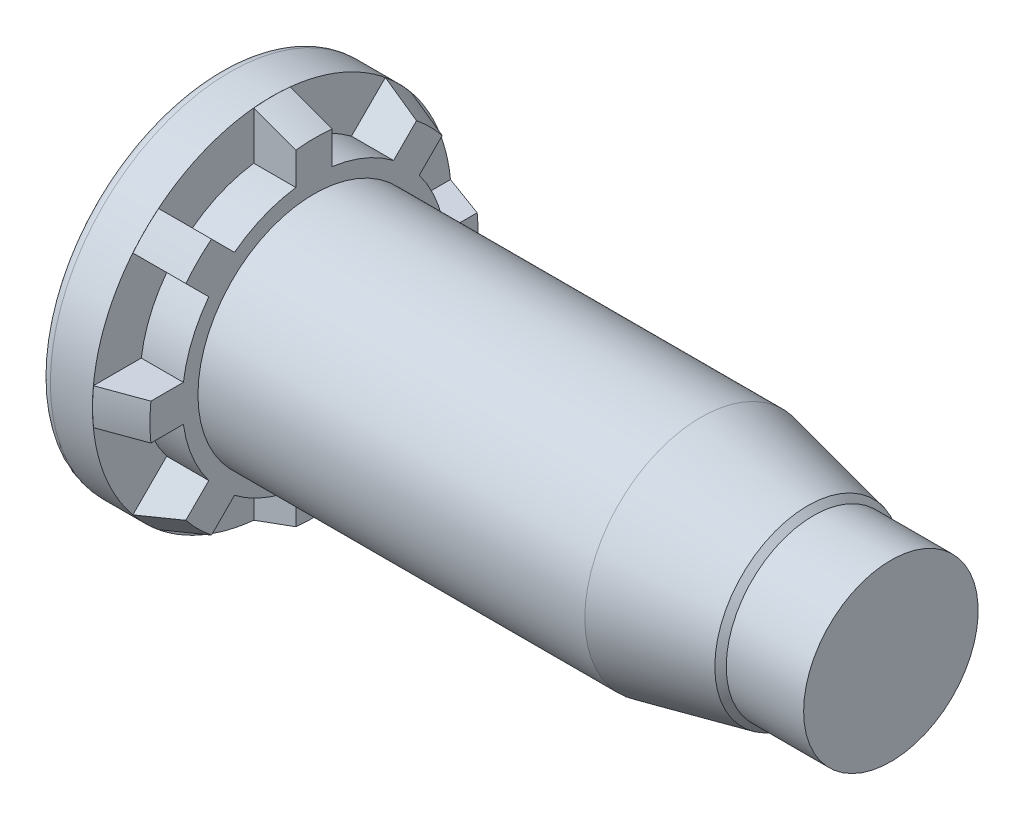
from build123d import *

# Parameters (mm, degrees)
RIBCUT_START     = -1.7272
RIBCUT_DEPTH     = 1.7272
RIBCUTSPAT_COUNT = 8
RIBCUTSPAT_ANGLE = 315


with BuildPart() as part:
    # BodySke → BaseBody (revolve)
    with BuildSketch(Plane.XY):
        with BuildLine():
            Line((-2.159, 6.9342), (-2.159, 0))
            Line((-2.159, 0), (25.4, 0))
            Line((25.4, 0), (25.4, 3.5814))
            Line((25.4, 3.5814), (22.225, 3.5814))
            Line((22.225, 3.5814), (21.99005, 3.81635))
            Line((21.99005, 3.81635), (17.6022, 4.7625))
            Line((17.6022, 4.7625), (1.7272, 4.7625))
            Line((1.7272, 4.7625), (1.7272, 6.735735096))
            Line((1.7272, 6.735735096), (0.00254, 7.36346))
            Line((0.00254, 7.36346), (0, 7.36346))
            Line((0, 7.36346), (0, 7.366))
            Line((0, 7.366), (-1.7272, 7.366))
            ThreePointArc((-1.7272, 7.366), (-2.032528708, 7.239528708), (-2.159, 6.9342))
        make_face()
    revolve(axis=Axis((0, 0, 0), (1, 0, 0)))

    # RibCutSke → RibCut (cut)
    with BuildSketch(Plane(origin=(1.7272, 1.794401132, -0.090952894), x_dir=(0, 0, -1), z_dir=(1, 0, 0)).offset(RIBCUT_START)):
        with BuildLine():
            Line((0.654066246, 3.567461918), (0.654066246, 5.533825289))
            ThreePointArc((0.654066246, 5.533825289), (2.727893269, 5.010895504), (4.564077617, 3.91424555))
            Line((4.564077617, 3.91424555), (3.173648743, 2.523816676))
            ThreePointArc((3.173648743, 2.523816676), (1.980656032, 3.206905232), (0.654066246, 3.567461918))
        make_face()
    ribcut = extrude(amount=RIBCUT_DEPTH, mode=Mode.SUBTRACT)

    # RibCutsPat: RibCut ×8 about axis
    ribcutspat_axis = Axis((0, 0, 0), (1, 0, 0))
    for i in range(1, RIBCUTSPAT_COUNT):
        add(ribcut.rotate(ribcutspat_axis, i * RIBCUTSPAT_ANGLE / (RIBCUTSPAT_COUNT - 1)), mode=Mode.SUBTRACT)


solid = part.part
